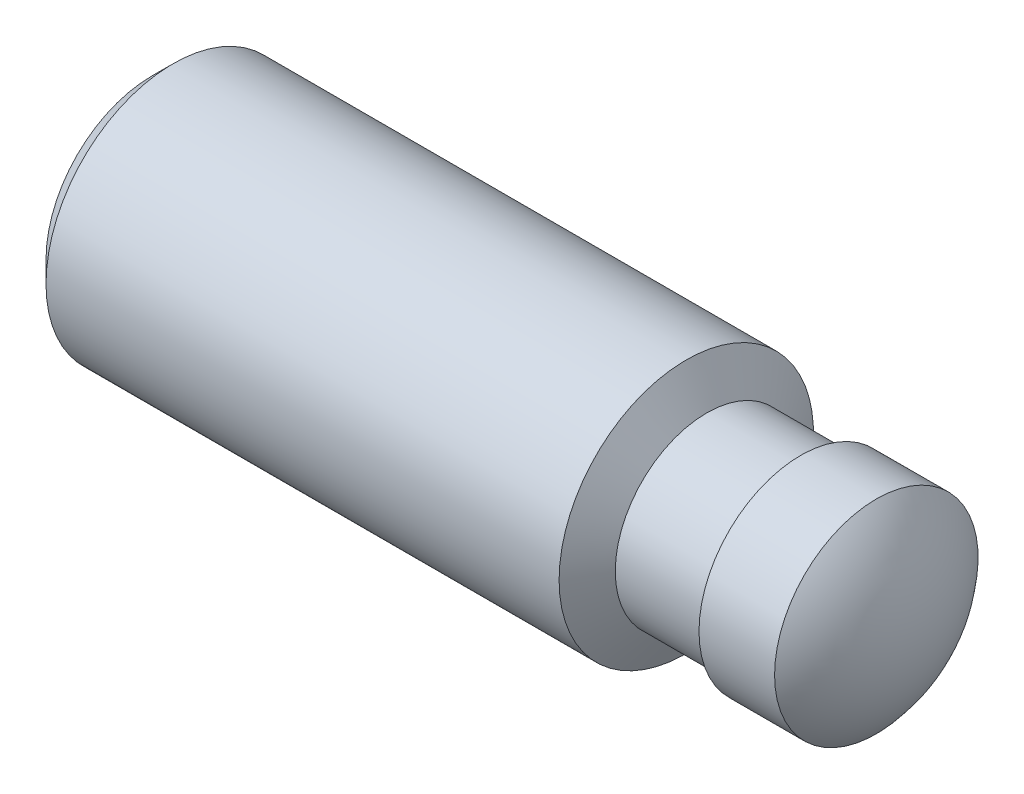
from build123d import *


with BuildPart() as part:
    # BodySke → BaseBody (revolve)
    with BuildSketch(Plane.XY):
        with BuildLine():
            Line((21.808290377, 3.6), (25.5, 3.6))
            Line((25.5, 3.6), (25.5, 4))
            Line((25.5, 4), (28.472135955, 4))
            ThreePointArc((28.472135955, 4), (29.605034154, 2.140932539), (30, 0))
            Line((30, 0), (0, 0))
            Line((0, 0), (0, 4.172))
            Line((0, 4.172), (0.828, 5))
            Line((0.828, 5), (21, 5))
            Line((21, 5), (21.808290377, 3.6))
        make_face()
    revolve(axis=Axis((-3.175, 0, 0), (1, 0, 0)))


solid = part.part
